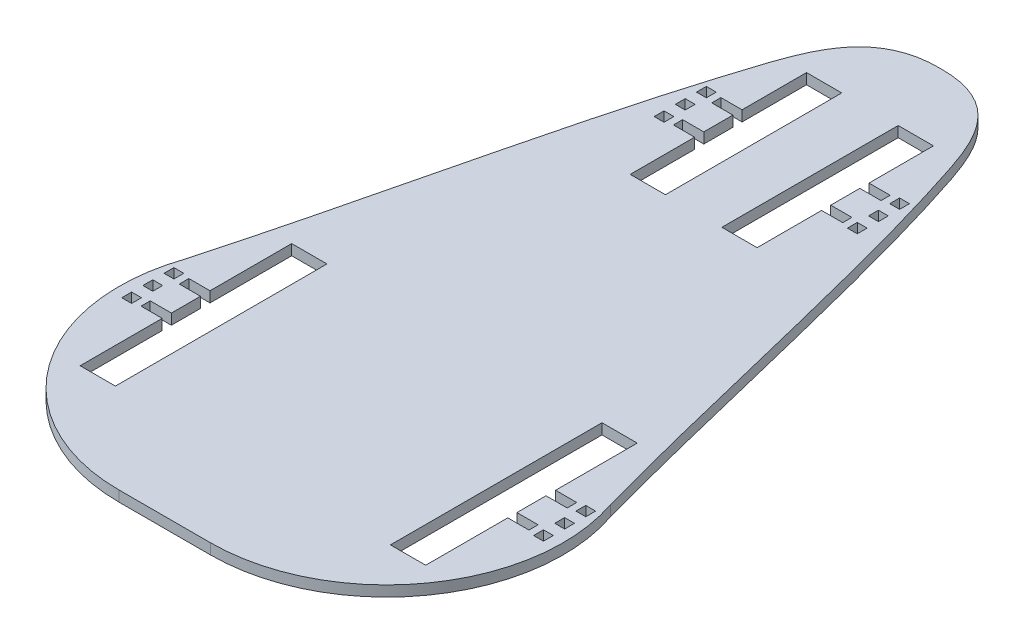
from build123d import *

# Parameters (mm, degrees)
SKETCH1_W           = 2.8
SKETCH1_H           = 2.8
BOSS_EXTRUDE1_DEPTH = 3


with BuildPart() as part:
    # Sketch1 → Boss-Extrude1 (new body)
    with BuildSketch(Plane(origin=(0, 0, 0), x_dir=(1, 0, 0), z_dir=(0, 1, 0))):
        with BuildLine():
            ThreePointArc((-5.402835127, 56.779324779), (1.307686844, 11.589069626), (41.94700211, -9.282833033))
            Line((41.94700211, -9.282833033), (44.921096065, -9.282833033))
            Line((44.921096065, -9.282833033), (54.921096065, -9.282833033))
            Line((54.921096065, -9.282833033), (64.921096065, -9.282833033))
            Line((64.921096065, -9.282833033), (67.895190019, -9.282833033))
            ThreePointArc((67.895190019, -9.282833033), (108.534505285, 11.589069626), (115.245027256, 56.779324779))
            add(Edge.make_bspline(
                [(54.921096065, 210.717166967), (55.81137077, 210.717166967), (73.117418641, 210.307735596), (83.168598293, 181.782075712), (97.327570014, 130.307145356), (107.26026966, 85.588568253), (115.245027256, 56.779324779)],
                knots=[0, 0, 0, 0, 0.011068307, 0.221366141, 0.459883166, 1, 1, 1, 1], degree=3))
            add(Edge.make_bspline(
                [(54.921096065, 210.717166967), (54.030821359, 210.717166967), (36.724773488, 210.307735596), (26.673593836, 181.782075712), (12.514622115, 130.307145356), (2.58192247, 85.588568253), (-5.402835127, 56.779324779)],
                knots=[0, 0, 0, 0, 0.011068307, 0.221366141, 0.459883166, 1, 1, 1, 1], degree=3))
        make_face()
        with Locations((-3.478903869, 39.717166967)):
            Rectangle(SKETCH1_W, SKETCH1_H, mode=Mode.SUBTRACT)
        with Locations((-3.478903935, 45.717166967)):
            Rectangle(SKETCH1_W, SKETCH1_H, mode=Mode.SUBTRACT)
        with Locations((-3.478903935, 51.717166967)):
            Rectangle(SKETCH1_W, SKETCH1_H, mode=Mode.SUBTRACT)
        Polygon((5.921096065, 52.548230604), (5.921096065, 75.717166967), (15.921096065, 75.717166967), (15.921096065, 15.717166967), (5.921096065, 15.717166967), (5.921096065, 38.99216559), (-0.078903869, 38.99216559), (-0.078903869, 41.59216559), (5.921096131, 41.59216559), (5.921096065, 49.842166967), (-0.078903935, 49.842166967), (-0.078903935, 52.548230604), align=None, mode=Mode.SUBTRACT)
        with Locations((113.321095998, 39.717166967)):
            Rectangle(SKETCH1_W, SKETCH1_H, mode=Mode.SUBTRACT)
        Polygon((103.921096065, 38.99216559), (103.921096065, 15.717166967), (93.921096065, 15.717166967), (93.921096065, 75.717166967), (103.921096065, 75.717166967), (103.921096065, 52.548230604), (109.921096065, 52.548230604), (109.921096065, 49.842166967), (103.921096065, 49.842166967), (103.921096065, 41.59216559), (109.921095998, 41.59216559), (109.921095998, 38.99216559), align=None, mode=Mode.SUBTRACT)
        with Locations((113.321096065, 45.717166967)):
            Rectangle(SKETCH1_W, SKETCH1_H, mode=Mode.SUBTRACT)
        with Locations((113.321096065, 51.717166967)):
            Rectangle(SKETCH1_W, SKETCH1_H, mode=Mode.SUBTRACT)
        with Locations((27.521096065, 159.717166967)):
            Rectangle(SKETCH1_W, SKETCH1_H, mode=Mode.SUBTRACT)
        with Locations((27.521096065, 165.717166967)):
            Rectangle(SKETCH1_W, SKETCH1_H, mode=Mode.SUBTRACT)
        Polygon((36.921096065, 172.442166967), (36.921096065, 190.717166967), (46.921096065, 190.717166967), (46.921096065, 140.717166967), (36.921096065, 140.717166967), (36.921096065, 158.992166967), (30.921096065, 158.992166967), (30.921096065, 161.592166967), (36.921096065, 161.592166967), (36.921096065, 169.842166967), (30.921096065, 169.842166967), (30.921096065, 172.442166967), align=None, mode=Mode.SUBTRACT)
        with Locations((27.521096065, 171.717166967)):
            Rectangle(SKETCH1_W, SKETCH1_H, mode=Mode.SUBTRACT)
        Polygon((72.921096065, 158.992166967), (72.921096065, 140.717166967), (62.921096065, 140.717166967), (62.921096065, 190.717166967), (72.921096065, 190.717166967), (72.921096065, 172.442166967), (78.921096065, 172.442166967), (78.921096065, 169.842166967), (72.921096065, 169.842166967), (72.921096065, 161.592166967), (78.921096065, 161.592166967), (78.921096065, 158.992166967), align=None, mode=Mode.SUBTRACT)
        with Locations((82.321096065, 159.717166967)):
            Rectangle(SKETCH1_W, SKETCH1_H, mode=Mode.SUBTRACT)
        with Locations((82.321096065, 165.717166967)):
            Rectangle(SKETCH1_W, SKETCH1_H, mode=Mode.SUBTRACT)
        with Locations((82.321096065, 171.717166967)):
            Rectangle(SKETCH1_W, SKETCH1_H, mode=Mode.SUBTRACT)
    extrude(amount=BOSS_EXTRUDE1_DEPTH)


solid = part.part
